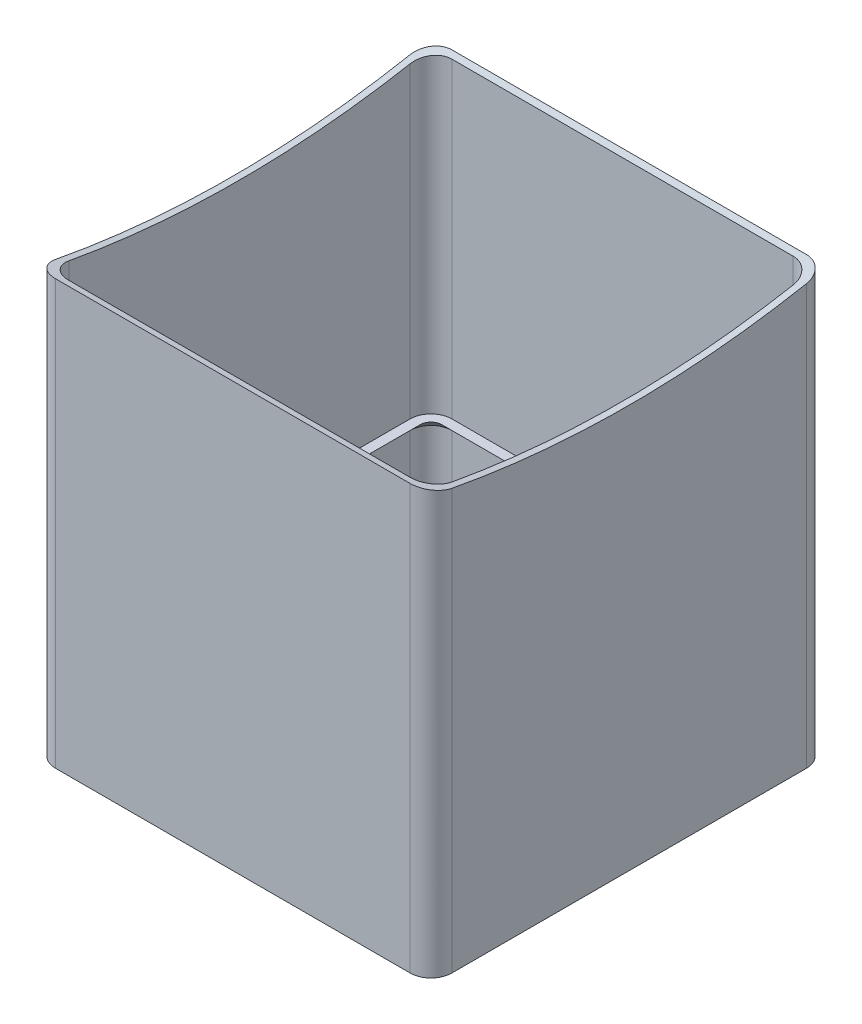
from build123d import *

# Parameters (mm, degrees)
SKETCH1_W           = 95
SKETCH1_H           = 95
BOSS_EXTRUDE1_DEPTH = 1.6
SKETCH2_W           = 95
SKETCH2_H           = 95
SKETCH2_W_2         = 91.8
SKETCH2_H_2         = 91.8
BOSS_EXTRUDE2_DEPTH = 100
CUT_EXTRUDE1_DEPTH  = 147.982345879
FILLET1_R           = 5
SKETCH4_W           = 53
SKETCH4_H           = 22
CUT_EXTRUDE2_DEPTH  = 1.6
SKETCH5_R           = 1.65
CUT_EXTRUDE3_DEPTH  = 121.467838193
SKETCH6_W           = 60
SKETCH6_H           = 15
CUT_EXTRUDE4_DEPTH  = 1.6
FILLET2_R           = 5
BOSS_EXTRUDE3_START = 25
BOSS_EXTRUDE3_DEPTH = 2.4
CHAMFER1_SIZE       = 2.4


with BuildPart() as part:
    # Sketch1 → Boss-Extrude1 (new body)
    with BuildSketch(Plane(origin=(0, 0, 0), x_dir=(1, 0, 0), z_dir=(0, 1, 0))):
        Rectangle(SKETCH1_W, SKETCH1_H)
    extrude(amount=BOSS_EXTRUDE1_DEPTH)

    # Sketch2 → Boss-Extrude2 (add)
    with BuildSketch(Plane(origin=(0, 1.6, 0), x_dir=(1, 0, 0), z_dir=(0, 1, 0))):
        Rectangle(SKETCH2_W, SKETCH2_H)
        Rectangle(SKETCH2_W_2, SKETCH2_H_2, mode=Mode.SUBTRACT)
    extrude(amount=BOSS_EXTRUDE2_DEPTH)

    # Sketch3 → Cut-Extrude1 (cut, through all)
    with BuildSketch(Plane(origin=(47.5, 0, 0), x_dir=(0, 0, -1), z_dir=(1, 0, 0))):
        with BuildLine():
            Line((-47.5, 101.6), (47.5, 101.6))
            ThreePointArc((47.5, 101.6), (0, 96.6), (-47.5, 101.6))
        make_face()
    extrude(amount=-CUT_EXTRUDE1_DEPTH, mode=Mode.SUBTRACT)

    # Fillet1
    fillet1_edges = [part.edges().sort_by_distance(p)[0] for p in [
        (-45.9, 51.432685688, -45.9),
        (-45.9, 51.432685688, 45.9),
        (45.9, 51.432685688, -45.9),
        (45.9, 51.432685688, 45.9),
        (47.5, 50.8, 47.5),
        (-47.5, 50.8, 47.5),
        (-47.5, 50.8, -47.5),
        (47.5, 50.8, -47.5),
    ]]
    fillet(fillet1_edges, radius=FILLET1_R)

    # Sketch4 → Cut-Extrude2 (cut)
    with BuildSketch(Plane.ZY.offset(47.5)):
        with Locations((0, 11)):
            Rectangle(SKETCH4_W, SKETCH4_H)
    extrude(amount=-CUT_EXTRUDE2_DEPTH, mode=Mode.SUBTRACT)

    # Sketch5 → Cut-Extrude3 (cut, through all)
    with BuildSketch(Plane(origin=(0, 1.6, 0), x_dir=(1, 0, 0), z_dir=(0, 1, 0))):
        with Locations(Location((-22.4, 24.5, 0), (0, 0, 270))):
            Circle(SKETCH5_R)
        with Locations(Location((35.6, 24.5, 0), (0, 0, 270))):
            Circle(SKETCH5_R)
        with Locations(Location((35.6, -24.5, 0), (0, 0, 270))):
            Circle(SKETCH5_R)
        with Locations(Location((-22.4, -24.5, 0), (0, 0, 270))):
            Circle(SKETCH5_R)
    extrude(amount=-CUT_EXTRUDE3_DEPTH, mode=Mode.SUBTRACT)

    # Sketch6 → Cut-Extrude4 (cut)
    with BuildSketch(Plane(origin=(0, 0, -47.5), x_dir=(-1, 0, 0), z_dir=(0, 0, -1))):
        with Locations((-6.6, 7.5)):
            Rectangle(SKETCH6_W, SKETCH6_H)
    extrude(amount=-CUT_EXTRUDE4_DEPTH, mode=Mode.SUBTRACT)

    # Fillet2
    fillet2_edges = [part.edges().sort_by_distance(p)[0] for p in [
        (-23.4, 15, -46.7),
        (36.6, 15, -46.7),
    ]]
    fillet(fillet2_edges, radius=FILLET2_R)

    # Sketch7 → Boss-Extrude3 (add)
    with BuildSketch(Plane(origin=(0, 1.6, 0), x_dir=(1, 0, 0), z_dir=(0, 1, 0)).offset(BOSS_EXTRUDE3_START)):
        with BuildLine():
            Line((-40.9, -45.9), (40.9, -45.9))
            ThreePointArc((40.9, -45.9), (44.435533906, -44.435533906), (45.9, -40.9))
            Line((45.9, -40.9), (45.9, 40.9))
            ThreePointArc((45.9, 40.9), (44.435533906, 44.435533906), (40.9, 45.9))
            Line((40.9, 45.9), (36.6, 45.9))
            Line((36.6, 45.9), (-23.4, 45.9))
            Line((-23.4, 45.9), (-40.9, 45.9))
            ThreePointArc((-40.9, 45.9), (-44.435533906, 44.435533906), (-45.9, 40.9))
            Line((-45.9, 40.9), (-45.9, 26.5))
            Line((-45.9, 26.5), (-45.9, -26.5))
            Line((-45.9, -26.5), (-45.9, -40.9))
            ThreePointArc((-45.9, -40.9), (-44.435533906, -44.435533906), (-40.9, -45.9))
        make_face()
        with BuildLine():
            Line((-40.9, -43.5), (40.9, -43.5))
            ThreePointArc((40.9, -43.5), (42.738477631, -42.738477631), (43.5, -40.9))
            Line((43.5, -40.9), (43.5, 40.9))
            ThreePointArc((43.5, 40.9), (42.738477631, 42.738477631), (40.9, 43.5))
            Line((40.9, 43.5), (36.6, 43.5))
            Line((36.6, 43.5), (-23.4, 43.5))
            Line((-23.4, 43.5), (-40.9, 43.5))
            ThreePointArc((-40.9, 43.5), (-42.738477631, 42.738477631), (-43.5, 40.9))
            Line((-43.5, 40.9), (-43.5, 26.5))
            Line((-43.5, 26.5), (-43.5, -26.5))
            Line((-43.5, -26.5), (-43.5, -40.9))
            ThreePointArc((-43.5, -40.9), (-42.738477631, -42.738477631), (-40.9, -43.5))
        make_face(mode=Mode.SUBTRACT)
    extrude(amount=-BOSS_EXTRUDE3_DEPTH)

    # Chamfer1
    chamfer1_edges = [part.edges().sort_by_distance(p)[0] for p in [
        (0, 24.2, 43.5),
        (42.738477631, 24.2, 42.738477631),
        (-42.738477631, 24.2, 42.738477631),
        (43.5, 24.2, 0),
        (-43.5, 24.2, 0),
        (42.738477631, 24.2, -42.738477631),
        (-42.738477631, 24.2, -42.738477631),
        (0, 24.2, -43.5),
    ]]
    chamfer(chamfer1_edges, length=CHAMFER1_SIZE - 0.0001)  # a hair under: the kernel refuses the full size


solid = part.part
